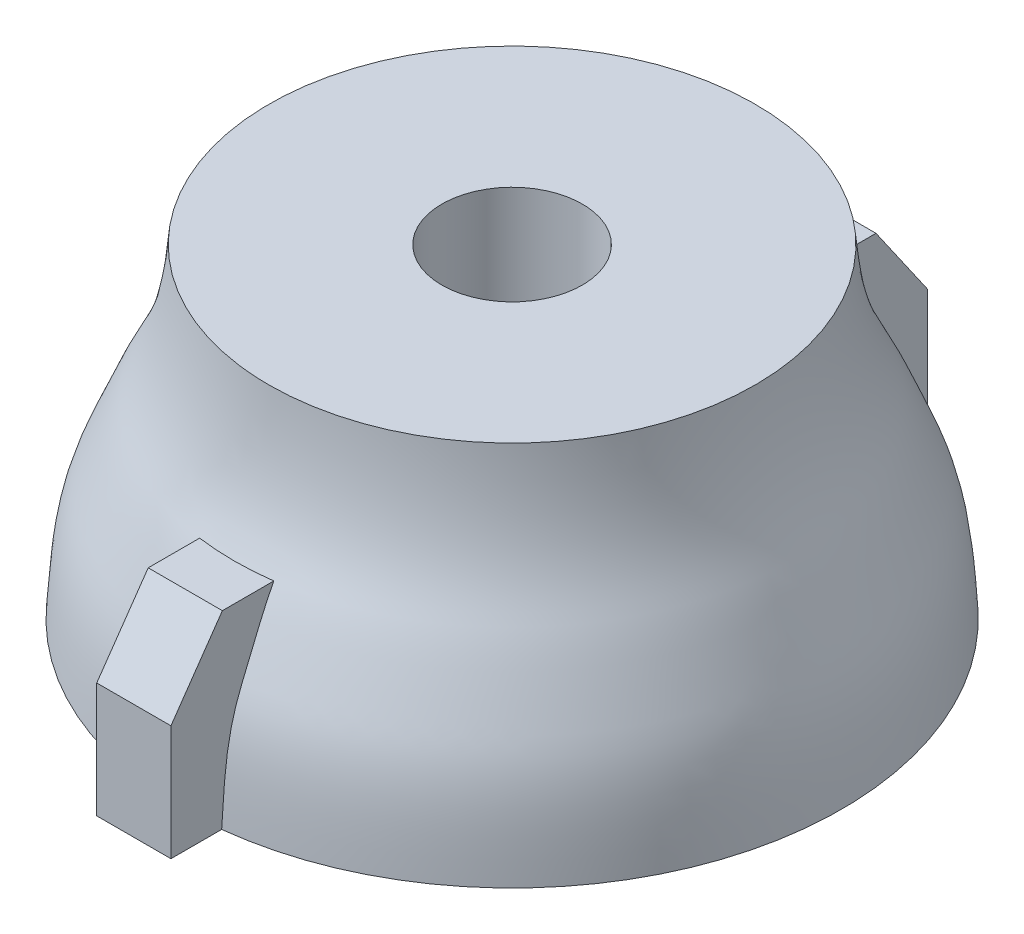
from build123d import *

# Parameters (mm, degrees)
BOSS_EXTRUDE1_DEPTH      = 8.89
BOSS_EXTRUDE1_DEPTH_BACK = 8.89
SKETCH2_W                = 1.743595682
SKETCH2_H                = 4.445
CUT_EXTRUDE1_DEPTH       = 23.084698183
SKETCH4_R                = 1.651
CUT_EXTRUDE2_DEPTH       = 15.039676415


with BuildPart() as part:
    # Sketch1 → Revolve1 (revolve)
    with BuildSketch(Plane.XY):
        with BuildLine():
            Line((0, -18.287102298), (-7.747, -18.287102298))
            add(Edge.make_bspline(
                [(-5.715, -10.667102298), (-5.869846153, -12.70802861), (-6.375262289, -13.489291996), (-6.812582975, -14.425826505), (-7.155496358, -15.258423362), (-7.613599496, -16.39705873), (-7.682627614, -17.183517429), (-7.747, -18.287102298)],
                knots=[0, 0, 0, 0, 0.274274867, 0.313987963, 0.387892843, 0.416790756, 0.593728988, 0.593728988, 0.593728988, 0.593728988], degree=3))
            Line((-5.715, -10.667102298), (0, -10.667102298))
            Line((0, -10.667102298), (0, -18.287102298))
        make_face()
    revolve(axis=Axis((0, 43.540719756, 0), (0, -1, 0)))

    # Sketch2 → Boss-Extrude1 (add, two sides: drawn at the far end of the back side and taken through both)
    with BuildSketch(Plane.XY.offset(-BOSS_EXTRUDE1_DEPTH_BACK)):
        with Locations((0, -16.064602298)):
            Rectangle(SKETCH2_W, SKETCH2_H)
    extrude(amount=BOSS_EXTRUDE1_DEPTH + BOSS_EXTRUDE1_DEPTH_BACK)

    # Sketch3 → Cut-Extrude1 (cut, through all)
    with BuildSketch(Plane(origin=(0.871797841, 0, 0), x_dir=(0, 0, -1), z_dir=(1, 0, 0))):
        Polygon((-7.68099649, -13.842102298), (-8.89, -15.581089585), (-8.89, -13.842102298), align=None)
    cut_extrude1 = extrude(amount=-CUT_EXTRUDE1_DEPTH, mode=Mode.SUBTRACT)

    # Mirror1: Cut-Extrude1 across plane
    add(cut_extrude1.mirror(Plane.XY), mode=Mode.SUBTRACT)

    # Sketch4 → Cut-Extrude2 (cut, through all)
    with BuildSketch(Plane(origin=(0, -10.667102298, 0), x_dir=(1, 0, 0), z_dir=(0, 1, 0))):
        Circle(SKETCH4_R)
    extrude(amount=-CUT_EXTRUDE2_DEPTH, mode=Mode.SUBTRACT)


solid = part.part
